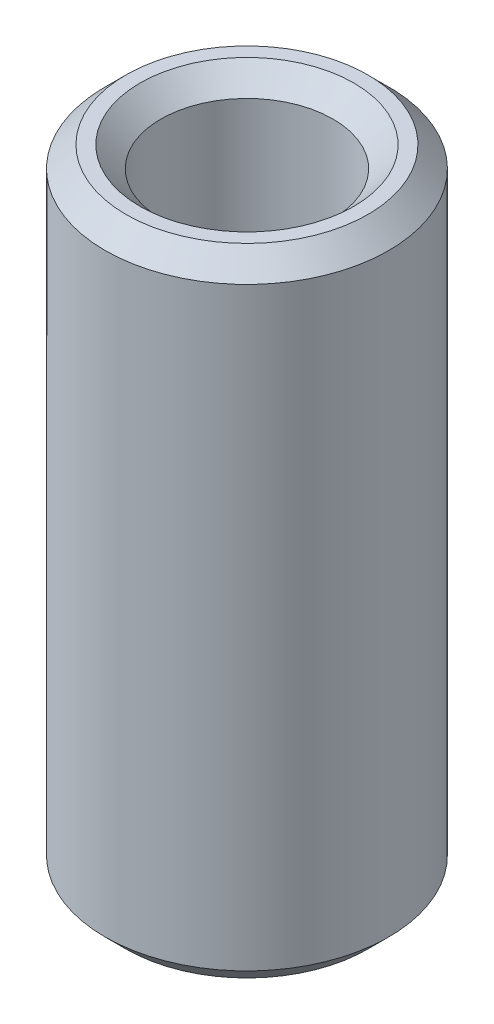
from build123d import *

# Parameters (mm, degrees)
SKETCH1_R           = 20
BOSS_EXTRUDE1_DEPTH = 89.75374715
SKETCH2_R           = 12.145967865
CUT_EXTRUDE1_DEPTH  = 95.104915533
CHAMFER1_SIZE       = 2.935883245


with BuildPart() as part:
    # Sketch1 → Boss-Extrude1 (new body)
    with BuildSketch(Plane(origin=(0, 0, 0), x_dir=(1, 0, 0), z_dir=(0, 1, 0))):
        Circle(SKETCH1_R)
    extrude(amount=BOSS_EXTRUDE1_DEPTH)

    # Sketch2 → Cut-Extrude1 (cut, through all)
    with BuildSketch(Plane(origin=(0, 0, 0), x_dir=(1, 0, 0), z_dir=(0, 1, 0))):
        Circle(SKETCH2_R)
    extrude(amount=CUT_EXTRUDE1_DEPTH, mode=Mode.SUBTRACT)

    # Chamfer1
    chamfer1_edges = [part.edges().sort_by_distance(p)[0] for p in [
        (-12.145967865, 89.75374715, 0),
        (-12.145967865, 0, 0),
        (-20, 0, 0),
        (-20, 89.75374715, 0),
    ]]
    chamfer(chamfer1_edges, length=CHAMFER1_SIZE)


solid = part.part
